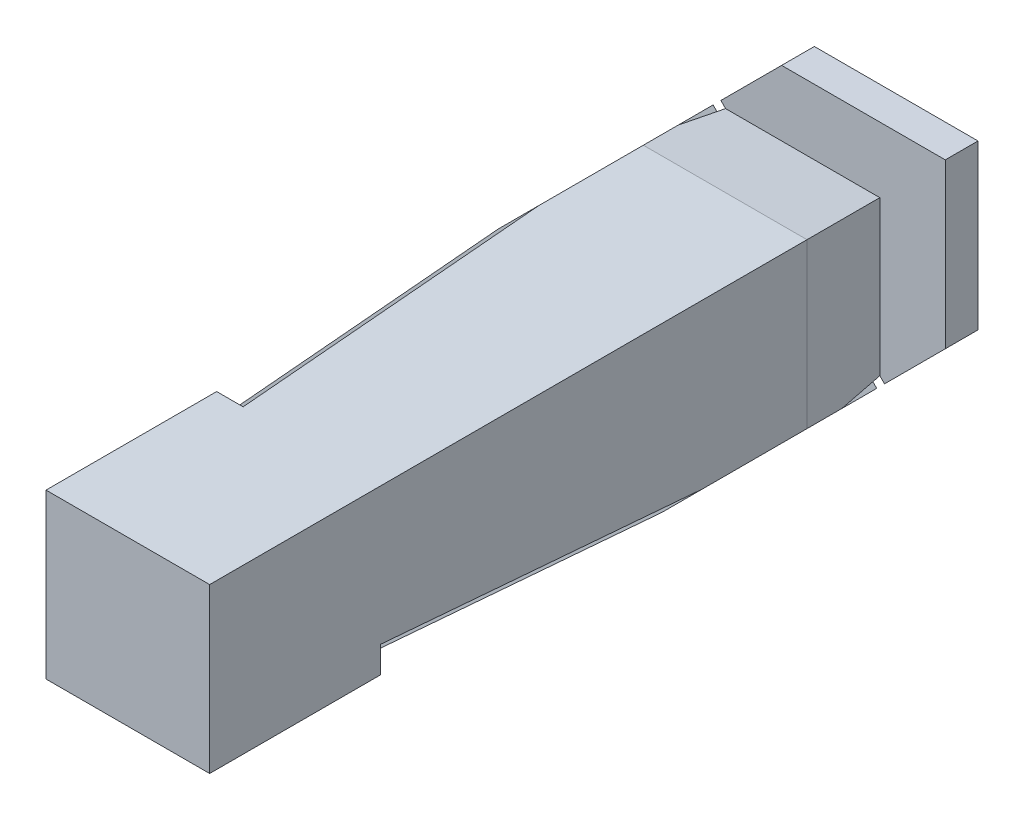
from build123d import *

# Parameters (mm, degrees)
SKETCH7_W               = 9.95
SKETCH7_H               = 9.95
BOSS_EXTRUDE1_DEPTH     = 1
CUT_EXTRUDE4_START      = -1
CUT_EXTRUDE4_DEPTH      = 16
CUT_EXTRUDE5_DEPTH      = 22.201444668
CUT_EXTRUDE5_DEPTH_BACK = 22.201444668
BOSS_EXTRUDE2_DEPTH     = 0.5
FILLET1_R               = 0.2
LPATTERN1_COUNT         = 14
LPATTERN1_PITCH         = 1
FILLET1_OF_LPATTERN1_R  = 0.2


# Read off the part's stored shape, not the designer's step: Cut-Extrude4
with BuildPart() as part:
    # Sketch1 → Loft1 section 0
    with BuildSketch(Plane.XY):
        with BuildLine():
            Line((-2.975, -2.975), (2.975, -2.975))
            Line((2.975, -2.975), (2.975, 2.975))
            Line((2.975, 2.975), (-2.975, 2.975))
            Line((-2.975, 2.975), (-2.975, -2.975))
        make_face()
    # Sketch5 → Loft1 section 1
    with BuildSketch(Plane.XY.offset(2.5)):
        with BuildLine():
            Line((-3.25, -3.25), (3.25, -3.25))
            Line((3.25, -3.25), (3.25, 3.25))
            Line((3.25, 3.25), (-3.25, 3.25))
            Line((-3.25, 3.25), (-3.25, -3.25))
        make_face()
    loft()

    # Sketch4 → Loft2 section 0
    with BuildSketch(Plane.XY.offset(20)):
        with BuildLine():
            Line((-2.5, -2.5), (2.5, -2.5))
            Line((2.5, -2.5), (2.5, 2.5))
            Line((2.5, 2.5), (-2.5, 2.5))
            Line((-2.5, 2.5), (-2.5, -2.5))
        make_face()
    # Sketch5<3> → Loft2 section 1
    with BuildSketch(Plane.XY.offset(2.5)):
        with BuildLine():
            Line((-3.25, -3.25), (3.25, -3.25))
            Line((3.25, -3.25), (3.25, 3.25))
            Line((3.25, 3.25), (-3.25, 3.25))
            Line((-3.25, 3.25), (-3.25, -3.25))
        make_face()
    loft()

    # Sketch7 → Boss-Extrude1 (add)
    with BuildSketch(Plane(origin=(0, 0, 0), x_dir=(-1, 0, 0), z_dir=(0, 0, -1))):
        Rectangle(SKETCH7_W, SKETCH7_H)
    extrude(amount=BOSS_EXTRUDE1_DEPTH)

    # Cut-Extrude4 outline → Cut-Extrude4 (cut)
    with BuildSketch(Plane.XY.offset(CUT_EXTRUDE4_START)):
        with BuildLine():
            Line((4.975, -4.975), (4.975, -3.737563133))
            Line((4.975, -3.737563133), (1.791322373, -0.553885506))
            ThreePointArc((1.791322373, -0.553885506), (1.325825215, 1.325825215), (-0.553885506, 1.791322373))
            Line((-0.553885506, 1.791322373), (-3.737563133, 4.975))
            Line((-3.737563133, 4.975), (-4.975, 4.975))
            Line((-4.975, 4.975), (-4.975, 3.737563133))
            Line((-4.975, 3.737563133), (-1.791322373, 0.553885506))
            ThreePointArc((-1.791322373, 0.553885506), (-1.325825215, -1.325825215), (0.553885506, -1.791322373))
            Line((0.553885506, -1.791322373), (3.737563133, -4.975))
            Line((3.737563133, -4.975), (4.975, -4.975))
        make_face()
    extrude(amount=CUT_EXTRUDE4_DEPTH, mode=Mode.SUBTRACT)

    # Sketch6<7> → Cut-Extrude5 (cut, two sides: drawn at the far end of the back side and taken through both)
    with BuildSketch(Plane.XY.offset(-CUT_EXTRUDE5_DEPTH_BACK)):
        Polygon((-4.356281566, 5.593718434), (-5.593718434, 4.356281566), (-4.975, 0.025), (-0.025, 4.975), align=None)
        Polygon((5.593718434, -4.356281566), (4.356281566, -5.593718434), (0.025, -4.975), (4.975, -0.025), align=None)
    extrude(amount=CUT_EXTRUDE5_DEPTH + CUT_EXTRUDE5_DEPTH_BACK, mode=Mode.SUBTRACT)

    # Sketch8 → Boss-Extrude2 (add)
    with BuildSketch(Plane.XY):
        with BuildLine():
            ThreePointArc((0.39123206, -1.628668927), (-1.184403858, -1.184403858), (-1.628668927, 0.39123206))
            Line((-1.628668927, 0.39123206), (-1.791322373, 0.553885506))
            ThreePointArc((-1.791322373, 0.553885506), (-1.325825215, -1.325825215), (0.553885506, -1.791322373))
            Line((0.553885506, -1.791322373), (0.39123206, -1.628668927))
        make_face()
        with BuildLine():
            Line((-0.553885506, 1.791322373), (-0.39123206, 1.628668927))
            ThreePointArc((-0.39123206, 1.628668927), (1.036897126, 1.315473052), (1.675, 0))
            ThreePointArc((1.675, 0), (1.663376905, -0.196982926), (1.628668927, -0.39123206))
            Line((1.628668927, -0.39123206), (1.791322373, -0.553885506))
            ThreePointArc((1.791322373, -0.553885506), (1.853962574, -0.280085299), (1.875, 0))
            ThreePointArc((1.875, 0), (1.112899294, 1.508999722), (-0.553885506, 1.791322373))
        make_face()
    boss_extrude2 = extrude(amount=BOSS_EXTRUDE2_DEPTH)

    # Fillet1
    fillet1_edges = [part.edges().sort_by_distance(p)[0] for p in [
        (-1.628668927, 0.39123206, 0.25),
        (0.39123206, -1.628668927, 0.25),
        (-1.184403858, -1.184403858, 0.5),
        (-1.184403858, -1.184403858, 0),
        (1.628668927, -0.39123206, 0.25),
        (-0.39123206, 1.628668927, 0.25),
        (1.184403858, 1.184403858, 0.5),
        (1.184403858, 1.184403858, 0),
    ]]
    fillet(fillet1_edges, radius=FILLET1_R - 0.0001)  # a hair under: the kernel refuses the full size

    # LPattern1: Boss-Extrude2 ×14
    with Locations(*[(0, 0, i * LPATTERN1_PITCH) for i in range(1, LPATTERN1_COUNT)]):
        add(boss_extrude2)

    # Fillet1 of LPattern1
    fillet1_of_lpattern1_edges = [part.edges().sort_by_distance(p)[0] for p in [
        (-1.628668927, 0.39123206, 1.25),
        (0.39123206, -1.628668927, 1.25),
        (-1.184403858, -1.184403858, 1.5),
        (-1.184403858, -1.184403858, 1),
        (1.628668927, -0.39123206, 1.25),
        (-0.39123206, 1.628668927, 1.25),
        (1.184403858, 1.184403858, 1.5),
        (1.184403858, 1.184403858, 1),
        (-1.628668927, 0.39123206, 2.25),
        (0.39123206, -1.628668927, 2.25),
        (-1.184403858, -1.184403858, 2.5),
        (-1.184403858, -1.184403858, 2),
        (1.628668927, -0.39123206, 2.25),
        (-0.39123206, 1.628668927, 2.25),
        (1.184403858, 1.184403858, 2.5),
        (1.184403858, 1.184403858, 2),
        (-1.628668927, 0.39123206, 3.25),
        (0.39123206, -1.628668927, 3.25),
        (-1.184403858, -1.184403858, 3.5),
        (-1.184403858, -1.184403858, 3),
        (1.628668927, -0.39123206, 3.25),
        (-0.39123206, 1.628668927, 3.25),
        (1.184403858, 1.184403858, 3.5),
        (1.184403858, 1.184403858, 3),
        (-1.628668927, 0.39123206, 4.25),
        (0.39123206, -1.628668927, 4.25),
        (-1.184403858, -1.184403858, 4.5),
        (-1.184403858, -1.184403858, 4),
        (1.628668927, -0.39123206, 4.25),
        (-0.39123206, 1.628668927, 4.25),
        (1.184403858, 1.184403858, 4.5),
        (1.184403858, 1.184403858, 4),
        (-1.628668927, 0.39123206, 5.25),
        (0.39123206, -1.628668927, 5.25),
        (-1.184403858, -1.184403858, 5.5),
        (-1.184403858, -1.184403858, 5),
        (1.628668927, -0.39123206, 5.25),
        (-0.39123206, 1.628668927, 5.25),
        (1.184403858, 1.184403858, 5.5),
        (1.184403858, 1.184403858, 5),
        (-1.628668927, 0.39123206, 6.25),
        (0.39123206, -1.628668927, 6.25),
        (-1.184403858, -1.184403858, 6.5),
        (-1.184403858, -1.184403858, 6),
        (1.628668927, -0.39123206, 6.25),
        (-0.39123206, 1.628668927, 6.25),
        (1.184403858, 1.184403858, 6.5),
        (1.184403858, 1.184403858, 6),
        (-1.628668927, 0.39123206, 7.25),
        (0.39123206, -1.628668927, 7.25),
        (-1.184403858, -1.184403858, 7.5),
        (-1.184403858, -1.184403858, 7),
        (1.628668927, -0.39123206, 7.25),
        (-0.39123206, 1.628668927, 7.25),
        (1.184403858, 1.184403858, 7.5),
        (1.184403858, 1.184403858, 7),
        (-1.628668927, 0.39123206, 8.25),
        (0.39123206, -1.628668927, 8.25),
        (-1.184403858, -1.184403858, 8.5),
        (-1.184403858, -1.184403858, 8),
        (1.628668927, -0.39123206, 8.25),
        (-0.39123206, 1.628668927, 8.25),
        (1.184403858, 1.184403858, 8.5),
        (1.184403858, 1.184403858, 8),
        (-1.628668927, 0.39123206, 9.25),
        (0.39123206, -1.628668927, 9.25),
        (-1.184403858, -1.184403858, 9.5),
        (-1.184403858, -1.184403858, 9),
        (1.628668927, -0.39123206, 9.25),
        (-0.39123206, 1.628668927, 9.25),
        (1.184403858, 1.184403858, 9.5),
        (1.184403858, 1.184403858, 9),
        (-1.628668927, 0.39123206, 10.25),
        (0.39123206, -1.628668927, 10.25),
        (-1.184403858, -1.184403858, 10.5),
        (-1.184403858, -1.184403858, 10),
        (1.628668927, -0.39123206, 10.25),
        (-0.39123206, 1.628668927, 10.25),
        (1.184403858, 1.184403858, 10.5),
        (1.184403858, 1.184403858, 10),
        (-1.628668927, 0.39123206, 11.25),
        (0.39123206, -1.628668927, 11.25),
        (-1.184403858, -1.184403858, 11.5),
        (-1.184403858, -1.184403858, 11),
        (1.628668927, -0.39123206, 11.25),
        (-0.39123206, 1.628668927, 11.25),
        (1.184403858, 1.184403858, 11.5),
        (1.184403858, 1.184403858, 11),
        (-1.628668927, 0.39123206, 12.25),
        (0.39123206, -1.628668927, 12.25),
        (-1.184403858, -1.184403858, 12.5),
        (-1.184403858, -1.184403858, 12),
        (1.628668927, -0.39123206, 12.25),
        (-0.39123206, 1.628668927, 12.25),
        (1.184403858, 1.184403858, 12.5),
        (1.184403858, 1.184403858, 12),
        (-1.628668927, 0.39123206, 13.25),
        (0.39123206, -1.628668927, 13.25),
        (-1.184403858, -1.184403858, 13.5),
        (-1.184403858, -1.184403858, 13),
        (1.628668927, -0.39123206, 13.25),
        (-0.39123206, 1.628668927, 13.25),
        (1.184403858, 1.184403858, 13.5),
        (1.184403858, 1.184403858, 13),
    ]]
    fillet(fillet1_of_lpattern1_edges, radius=FILLET1_OF_LPATTERN1_R - 0.0001)  # a hair under: the kernel refuses the full size


solid = part.part
